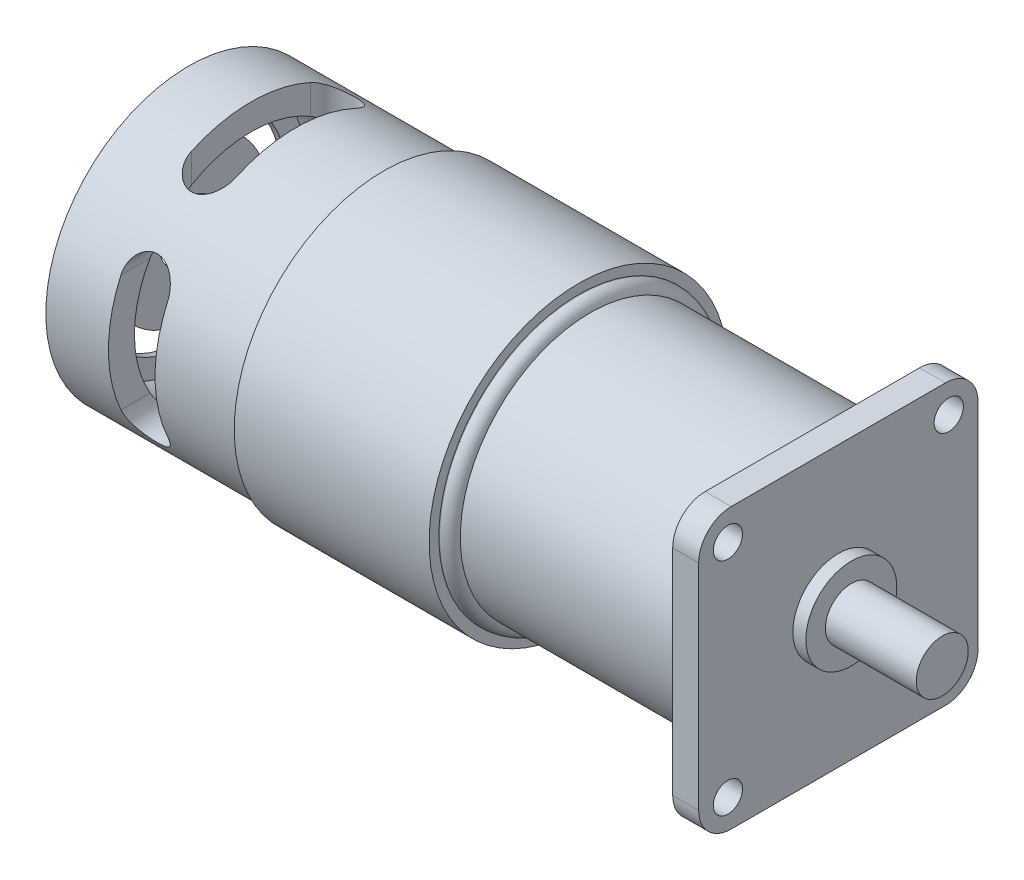
from build123d import *

# Parameters (mm, degrees)
SKETCH_11_W               = 43
SKETCH_11_H               = 43
EXTRUDE_4_DEPTH           = 4
SKETCH_12_R               = 18
CUT_EXTRUDE_1_DEPTH       = 60
SKETCH_13_R               = 4
EXTRUDE_5_DEPTH           = 62
EXTRUDE_START             = 1
SKETCH_14_R               = 20
EXTRUDE_6_DEPTH           = 1
FILLET_1_R                = 0.5
CUT_EXTRUDE_6_DEPTH       = 10
SKETCH_19_R               = 1.729062575
EXTRUDE_9_DEPTH           = 2
FILLET_2_R                = 1.7
SKETCH_20_R               = 4.5
CUT_EXTRUDE_9_DEPTH       = 2
SKETCH_21_R               = 21.5
EXTRUDE_10_DEPTH          = 1.8
FILLET_3_R                = 1.7
CUT_EXTRUDE_10_DEPTH      = 121.474063599
CUT_EXTRUDE_10_DEPTH_BACK = 121.474063599
CUT_EXTRUDE_11_DEPTH      = 127.530628703
CUT_EXTRUDE_11_DEPTH_BACK = 127.530628703
SKETCH_48_R               = 4
EXTRUDE_11_DEPTH          = 18.5
SKETCH_49_R               = 2.25
CUT_EXTRUDE_12_DEPTH      = 18.5
SKETCH_50_R               = 2.25
CUT_EXTRUDE_13_DEPTH      = 18.5
FILLET_4_R                = 5


with BuildPart() as part:
    # 草图1 → 旋转1 (revolve)
    with BuildSketch(Plane.XY, mode=Mode.PRIVATE) as revolve_1_sk:
        Polygon((96, 20), (60, 20), (60, 23), (30, 23), (30, 22), (0, 22), (0, 0), (96, 0), align=None)
    revolve(revolve_1_sk.sketch.rotate(Axis((96, 0, 0), (-1, 0, 0)), 90), axis=Axis((96, 0, 0), (-1, 0, 0)))

    # 草图2 → 旋转2 (revolve)
    with BuildSketch(Plane.XY):
        Polygon((96, 0), (96, 7), (102, 7), (102, 4), (116, 4), (116, 0), align=None)
    revolve(axis=Axis((116, 0, 0), (-1, 0, 0)))

    # 草图12 → 切除-拉伸1 (cut)
    with BuildSketch(Plane.ZY):
        Circle(SKETCH_12_R)
    extrude(amount=-CUT_EXTRUDE_1_DEPTH, mode=Mode.SUBTRACT)

    # 草图13 → 凸台-拉伸5 (add)
    with BuildSketch(Plane.ZY.offset(-60)):
        with Locations(Location((0, 0, 0), (0, 0, 90))):
            Circle(SKETCH_13_R)
    extrude(amount=EXTRUDE_5_DEPTH)

    # 草图14 → 凸台-拉伸6 (add)
    with BuildSketch(Plane.ZY.offset(EXTRUDE_START)):
        with Locations(Location((0, 0, 0), (0, 0, 180))):
            Circle(SKETCH_14_R)
    extrude(amount=-EXTRUDE_6_DEPTH)

    # 圆角1
    fillet_1_edges = [part.edges().sort_by_distance(p)[0] for p in [
        (-1, 0, 20),
    ]]
    fillet(fillet_1_edges, radius=FILLET_1_R)

    # 草图17 → 切除-拉伸6 (cut)
    with BuildSketch(Plane.ZY.offset(1)):
        with BuildLine():
            ThreePointArc((0, 15.089699986), (-10.670029186, 10.670029186), (-15.089699986, 0))
            ThreePointArc((-15.089699986, 0), (-13.477073362, -1.612626625), (-11.864446737, 0))
            ThreePointArc((-11.864446737, 0), (-8.389430743, 8.389430743), (0, 11.864446737))
            ThreePointArc((0, 11.864446737), (1.612626625, 13.477073362), (0, 15.089699986))
        make_face()
        with BuildLine():
            ThreePointArc((0, -15.089699986), (10.670029186, -10.670029186), (15.089699986, 0))
            ThreePointArc((15.089699986, 0), (13.477073362, 1.612626625), (11.864446737, 0))
            ThreePointArc((11.864446737, 0), (8.389430743, -8.389430743), (0, -11.864446737))
            ThreePointArc((0, -11.864446737), (-1.612626625, -13.477073362), (0, -15.089699986))
        make_face()
    extrude(amount=-CUT_EXTRUDE_6_DEPTH, mode=Mode.SUBTRACT)

    # 草图19 → 凸台-拉伸9 (add)
    with BuildSketch(Plane.ZY.offset(2)):
        Circle(SKETCH_19_R)
    extrude(amount=EXTRUDE_9_DEPTH)

    # 圆角2
    fillet_2_edges = [part.edges().sort_by_distance(p)[0] for p in [
        (-4, 0, -1.729062575),
    ]]
    fillet(fillet_2_edges, radius=FILLET_2_R)

    # 草图20 → 切除-拉伸9 (cut)
    with BuildSketch(Plane.ZY.offset(1)):
        Circle(SKETCH_20_R)
    extrude(amount=-CUT_EXTRUDE_9_DEPTH, mode=Mode.SUBTRACT)


with BuildPart() as body_2:
    # 草图11 → 凸台-拉伸4 (new body)
    with BuildSketch(Plane(origin=(96, 0, 0), x_dir=(0, 0, -1), z_dir=(1, 0, 0))):
        Rectangle(SKETCH_11_W, SKETCH_11_H)
    extrude(amount=EXTRUDE_4_DEPTH)

    # 草图49 → 切除-拉伸12 (cut)
    with BuildSketch(Plane(origin=(100, 0, 0), x_dir=(0, 0, -1), z_dir=(1, 0, 0))):
        with Locations((-17, 17)):
            Circle(SKETCH_49_R)
    cut_extrude_12 = extrude(amount=-CUT_EXTRUDE_12_DEPTH, mode=Mode.SUBTRACT)

    # 镜向1: 切除-拉伸12 across plane
    add(cut_extrude_12.mirror(Plane(origin=(0, 0, 0), x_dir=(1, 0, 0), z_dir=(0, 0, -1))), mode=Mode.SUBTRACT)

    # 草图50 → 切除-拉伸13 (cut)
    with BuildSketch(Plane(origin=(100, 0, 0), x_dir=(0, 0, -1), z_dir=(1, 0, 0))):
        with Locations((17, -17)):
            Circle(SKETCH_50_R)
    cut_extrude_13 = extrude(amount=-CUT_EXTRUDE_13_DEPTH, mode=Mode.SUBTRACT)

    # 镜向2: 切除-拉伸13 across plane
    add(cut_extrude_13.mirror(Plane(origin=(0, 0, 0), x_dir=(1, 0, 0), z_dir=(0, 0, -1))), mode=Mode.SUBTRACT)

    # 圆角4
    fillet_4_edges = [body_2.edges().sort_by_distance(p)[0] for p in [
        (98, -21.5, -21.5),
        (98, -21.5, 21.5),
        (98, 21.5, 21.5),
        (98, 21.5, -21.5),
    ]]
    fillet(fillet_4_edges, radius=FILLET_4_R)


with BuildPart() as cut_extrude_9_piece_1:
    # of the separate pieces the step leaves, piece 1, a body of its own (cut_extrude_9_pieces)
    add(part.part.solids().sort_by_distance((-1, 0, -19.5))[0])

    # 草图21 → 凸台-拉伸10 (add)
    with BuildSketch(Plane(origin=(60, 0, 0), x_dir=(0, 0, -1), z_dir=(1, 0, 0))):
        Circle(SKETCH_21_R)
    extrude(amount=EXTRUDE_10_DEPTH)

    # 圆角3
    # the kernel refuses this fillet: 1.7 mm, written as the material it takes off along each edge
    with BuildSketch(Plane(origin=(61.8, 0, 0), x_dir=(0, 0, -1), z_dir=(0, -1, 0))) as fillet_3_piece_1:
        with BuildLine():
            CenterArc((19.8, -1.688194302), FILLET_3_R, 0, 83.243672969)
            Line((20, 0), (20.004, 0.033763886))
            ThreePointArc((20.004, 0.033763886), (20.75, 0.034), (21.5, 0.034))
            Line((21.5, 0.034), (21.534, 0))
            Line((21.534, 0), (21.534, -1.688194302))
            Line((21.534, -1.688194302), (21.5, -1.688194302))
        make_face()
    revolve(axis=Axis((61.8, 0, 0), (1, 0, 0)), mode=Mode.SUBTRACT)

    # 草图45 → 切除-拉伸10 (cut, two sides: drawn at the far end of the back side and taken through both)
    with BuildSketch(Plane(origin=(0, 0, 0), x_dir=(1, 0, 0), z_dir=(0, 0, -1)).offset(-CUT_EXTRUDE_10_DEPTH_BACK)):
        with BuildLine():
            Line((9.638944571, -8.995044582), (9.638944571, 8.995044582))
            ThreePointArc((9.638944571, 8.995044582), (13.228815813, 12.584915825), (16.818687055, 8.995044582))
            Line((16.818687055, 8.995044582), (16.818687055, -8.995044582))
            ThreePointArc((16.818687055, -8.995044582), (13.228815813, -12.584915825), (9.638944571, -8.995044582))
        make_face()
    extrude(amount=CUT_EXTRUDE_10_DEPTH + CUT_EXTRUDE_10_DEPTH_BACK, mode=Mode.SUBTRACT)


with BuildPart() as cut_extrude_9_piece_2:
    # of the separate pieces the step leaves, piece 2, a body of its own (cut_extrude_9_pieces)
    add(part.part.solids().sort_by_distance((-2.3, 0, 1.729062575))[0])


with BuildPart() as cut_extrude_10_piece_1:
    # of the separate pieces the step leaves, piece 1, a body of its own (cut_extrude_10_pieces)
    add(cut_extrude_9_piece_1.part.solids().sort_by_distance((-1, 0, -19.5))[0])


with BuildPart() as cut_extrude_10_piece_2:
    # of the separate pieces the step leaves, piece 2, a body of its own (cut_extrude_10_pieces)
    add(cut_extrude_9_piece_1.part.solids().sort_by_distance((9.638944571, 4, 0))[0])


with BuildPart() as cut_extrude_11_tool:
    # 草图46 → 切除-拉伸11 (new, two sides: drawn at the far end of the back side and taken through both)
    with BuildSketch(Plane(origin=(0, 22, 0), x_dir=(1, 0, 0), z_dir=(0, 1, 0)).offset(-CUT_EXTRUDE_11_DEPTH_BACK)):
        with BuildLine():
            Line((9.587474287, -9.164387171), (9.587474287, 9.164387171))
            ThreePointArc((9.587474287, 9.164387171), (13.032732622, 12.609645506), (16.477990957, 9.164387171))
            Line((16.477990957, 9.164387171), (16.477990957, -9.164387171))
            ThreePointArc((16.477990957, -9.164387171), (13.032732622, -12.609645506), (9.587474287, -9.164387171))
        make_face()
    extrude(amount=CUT_EXTRUDE_11_DEPTH + CUT_EXTRUDE_11_DEPTH_BACK)


with BuildPart() as cut_extrude_10_piece_1_1:
    add(cut_extrude_10_piece_1.part)

    # 切除-拉伸11: cut by cut_extrude_11_tool
    add(cut_extrude_11_tool.part, mode=Mode.SUBTRACT)


with BuildPart() as cut_extrude_10_piece_2_1:
    add(cut_extrude_10_piece_2.part)

    # 切除-拉伸11: cut by cut_extrude_11_tool
    add(cut_extrude_11_tool.part, mode=Mode.SUBTRACT)


with BuildPart() as extrude_11_tool:
    # 草图48 → 凸台-拉伸11 (new body)
    with BuildSketch(Plane.ZY.offset(-16.818687055)):
        Circle(SKETCH_48_R)
    extrude(amount=EXTRUDE_11_DEPTH)


with BuildPart() as cut_extrude_9_piece_2_1:
    add(cut_extrude_9_piece_2.part)


with BuildPart() as cut_extrude_9_piece_2_2:
    # 凸台-拉伸11: joined with extrude_11_tool
    add(cut_extrude_9_piece_2_1.part.fuse(extrude_11_tool.part, cut_extrude_10_piece_1_1.part, cut_extrude_10_piece_2_1.part, tol=0.00001))


solid = Compound([body_2.part, cut_extrude_9_piece_2_2.part])
